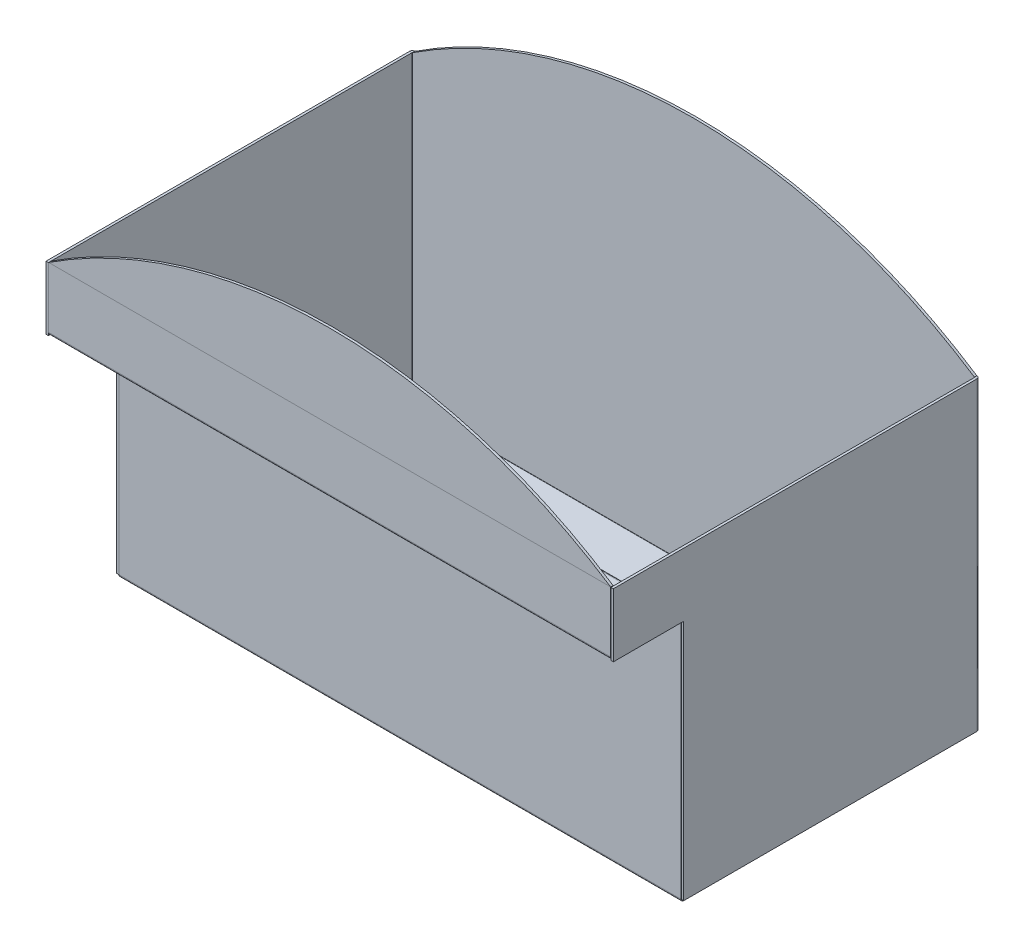
from build123d import *

# Parameters (mm, degrees)
EXTRUDE_1_DEPTH                  = 1
SKETCH_5_W                       = 231.74052668
SKETCH_5_H                       = 25
SM_BASE_FLANGE_1_DEPTH           = 1
SM_EDGE_FLANGE_1_DEPTH           = 231.74052668
SM_EDGE_FLANGE_2_STRIP_W         = 4.2
SM_EDGE_FLANGE_2_STRIP_H         = 1
SM_EDGE_FLANGE_2_STRIP_CUT_DEPTH = 231.74052668
SM_EDGE_FLANGE_2_DEPTH           = 231.74052668
SM_EDGE_FLANGE_3_STRIP_W         = 4.2
SM_EDGE_FLANGE_3_STRIP_H         = 1
SM_EDGE_FLANGE_3_STRIP_CUT_DEPTH = 231.74052668
SM_EDGE_FLANGE_3_DEPTH           = 231.74052668
SM_EDGE_FLANGE_4_STRIP_W         = 4.2
SM_EDGE_FLANGE_4_STRIP_H         = 1
SM_EDGE_FLANGE_4_STRIP_CUT_DEPTH = 231.74052668
SM_EDGE_FLANGE_4_DEPTH           = 231.74052668
SM_START                         = -1
SM_EDGE_FLANGE_4_FLAT_DEPTH      = 1
SM_EDGE_FLANGE_5_DEPTH           = 125.9
SM_EDGE_FLANGE_6_DEPTH           = 125.9
SKETCH_33_W                      = 29
SKETCH_33_H                      = 99.8
CUT_EXTRUDE_4_DEPTH              = 322.180288583


# Sheet-metal steps are written as plain solids
with BuildPart() as part:
    # Sketch 1 → Вытянуть1 (new body)
    with BuildSketch(Plane.XY):
        with BuildLine():
            Line((-97.680090168, -33.923624823), (134.060436512, -33.923624823))
            ThreePointArc((134.060436512, -33.923624823), (18.190173172, 0.595554476), (-97.680090168, -33.923624823))
        make_face()
    extrude(amount=EXTRUDE_1_DEPTH)


with BuildPart() as body_2:
    # Эскиз5 → Базовая кромка1 (new body)
    with BuildSketch(Plane(origin=(0, 0, 0), x_dir=(-1, 0, 0), z_dir=(0, 0, -1))):
        with Locations((-18.190173172, -46.423624823)):
            Rectangle(SKETCH_5_W, SKETCH_5_H)
    extrude(amount=-SM_BASE_FLANGE_1_DEPTH)

    # Ребро-кромка1 section (across the edge) → Ребро-кромка1 (add)
    with BuildSketch(Plane(origin=(134.060436512, -59.023624823, 0), x_dir=(0, 1, 0), z_dir=(-1, 0, 0))):
        with BuildLine():
            Line((-1, 0.1), (-1, 28))
            Line((-1, 28), (0, 28))
            Line((0, 28), (0, 0.1))
            ThreePointArc((0, 0.1), (0.029289322, 0.029289322), (0.1, 0))
            Line((0.1, 0), (0.1, -1))
            ThreePointArc((0.1, -1), (-0.677817459, -0.677817459), (-1, 0.1))
        make_face()
    extrude(amount=SM_EDGE_FLANGE_1_DEPTH)

    # Ребро-кромка2 strip (across the edge) → Ребро-кромка2 strip cut (cut)
    with BuildSketch(Plane(origin=(-97.680090168, -60.023624823, -28), x_dir=(0, 0, 1), z_dir=(1, 0, 0))):
        with Locations((-2, -0.5)):
            Rectangle(SM_EDGE_FLANGE_2_STRIP_W, SM_EDGE_FLANGE_2_STRIP_H)
    extrude(amount=SM_EDGE_FLANGE_2_STRIP_CUT_DEPTH, mode=Mode.SUBTRACT)

    # Ребро-кромка2 section (across the edge) → Ребро-кромка2 (add)
    with BuildSketch(Plane(origin=(-97.680090168, -60.023624823, -28), x_dir=(0, 0, 1), z_dir=(1, 0, 0))):
        with BuildLine():
            Line((-1, 0.1), (-1, 100))
            Line((-1, 100), (0, 100))
            Line((0, 100), (0, 0.1))
            ThreePointArc((0, 0.1), (0.029289322, 0.029289322), (0.1, 0))
            Line((0.1, 0), (0.1, -1))
            ThreePointArc((0.1, -1), (-0.677817459, -0.677817459), (-1, 0.1))
        make_face()
    extrude(amount=SM_EDGE_FLANGE_2_DEPTH)

    # Ребро-кромка3 strip (across the edge) → Ребро-кромка3 strip cut (cut)
    with BuildSketch(Plane(origin=(134.060436512, -160.023624823, -29), x_dir=(0, 1, 0), z_dir=(-1, 0, 0))):
        with Locations((-2, -0.5)):
            Rectangle(SM_EDGE_FLANGE_3_STRIP_W, SM_EDGE_FLANGE_3_STRIP_H)
    extrude(amount=SM_EDGE_FLANGE_3_STRIP_CUT_DEPTH, mode=Mode.SUBTRACT)

    # Ребро-кромка3 section (across the edge) → Ребро-кромка3 (add)
    with BuildSketch(Plane(origin=(134.060436512, -160.023624823, -29), x_dir=(0, 1, 0), z_dir=(-1, 0, 0))):
        with BuildLine():
            Line((-1, 0.1), (-1, 120))
            Line((-1, 120), (0, 120))
            Line((0, 120), (0, 0.1))
            ThreePointArc((0, 0.1), (0.029289322, 0.029289322), (0.1, 0))
            Line((0.1, 0), (0.1, -1))
            ThreePointArc((0.1, -1), (-0.677817459, -0.677817459), (-1, 0.1))
        make_face()
    extrude(amount=SM_EDGE_FLANGE_3_DEPTH)

    # Ребро-кромка4 strip (across the edge) → Ребро-кромка4 strip cut (cut)
    with BuildSketch(Plane(origin=(134.060436512, -160.023624823, -149), x_dir=(0, 0, 1), z_dir=(-1, 0, 0))):
        with Locations((-2, -0.5)):
            Rectangle(SM_EDGE_FLANGE_4_STRIP_W, SM_EDGE_FLANGE_4_STRIP_H)
    extrude(amount=SM_EDGE_FLANGE_4_STRIP_CUT_DEPTH, mode=Mode.SUBTRACT)

    # Ребро-кромка4 bend section (across the edge) → Ребро-кромка4 (add)
    with BuildSketch(Plane(origin=(134.060436512, -160.023624823, -149), x_dir=(0, 0, 1), z_dir=(-1, 0, 0))):
        with BuildLine():
            Line((-1, 0.1), (0, 0.1))
            ThreePointArc((0, 0.1), (0.029289322, 0.029289322), (0.1, 0))
            Line((0.1, 0), (0.1, -1))
            ThreePointArc((0.1, -1), (-0.677817459, -0.677817459), (-1, 0.1))
        make_face()
    extrude(amount=SM_EDGE_FLANGE_4_DEPTH)

    # Ребро-кромка4 profile (on flange) → Ребро-кромка4 flat (add)
    with BuildSketch(Plane(origin=(0, -160.023624823, -149), x_dir=(1, 0, 0), z_dir=(0, 0, 1)).offset(SM_START)):
        with BuildLine():
            ThreePointArc((134.060436512, 126), (18.190173172, 160.619179382), (-97.680090168, 126))
            Line((-97.680090168, 126), (-97.680090168, 0.1))
            Line((-97.680090168, 0.1), (134.060436512, 0.1))
            Line((134.060436512, 0.1), (134.060436512, 126))
        make_face()
    extrude(amount=SM_EDGE_FLANGE_4_FLAT_DEPTH)

    # Ребро-кромка5 section (across the edge) → Ребро-кромка5 (add)
    with BuildSketch(Plane(origin=(-97.780090168, -34.023624823, -149), x_dir=(1, 0, 0), z_dir=(0, -1, 0))):
        with BuildLine():
            Line((-1, 0.1), (-1, 150))
            Line((-1, 150), (0, 150))
            Line((0, 150), (0, 0.1))
            ThreePointArc((0, 0.1), (0.029289322, 0.029289322), (0.1, 0))
            Line((0.1, 0), (0.1, -1))
            ThreePointArc((0.1, -1), (-0.677817459, -0.677817459), (-1, 0.1))
        make_face()
    extrude(amount=SM_EDGE_FLANGE_5_DEPTH)

    # Ребро-кромка6 section (across the edge) → Ребро-кромка6 (add)
    with BuildSketch(Plane(origin=(134.160436512, -159.923624823, -149), x_dir=(-1, 0, 0), z_dir=(0, 1, 0))):
        with BuildLine():
            Line((-1, 0.1), (-1, 150))
            Line((-1, 150), (0, 150))
            Line((0, 150), (0, 0.1))
            ThreePointArc((0, 0.1), (0.029289322, 0.029289322), (0.1, 0))
            Line((0.1, 0), (0.1, -1))
            ThreePointArc((0.1, -1), (-0.677817459, -0.677817459), (-1, 0.1))
        make_face()
    extrude(amount=SM_EDGE_FLANGE_6_DEPTH)

    # Эскиз33 → Вытянуть4 (cut, through all)
    with BuildSketch(Plane.ZY.offset(98.780090168)):
        with Locations((-13.5, -110.023624823)):
            Rectangle(SKETCH_33_W, SKETCH_33_H)
    extrude(amount=-CUT_EXTRUDE_4_DEPTH, mode=Mode.SUBTRACT)


solid = Compound([part.part, body_2.part])
